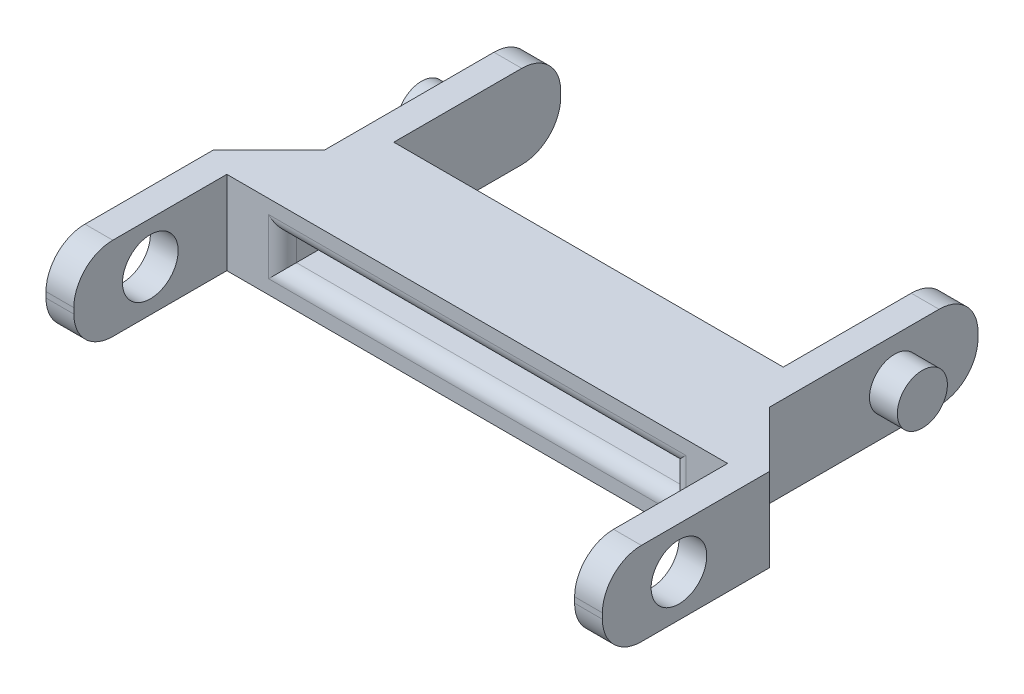
from build123d import *

# Parameters (mm, degrees)
SKETCH1_W           = 16
SKETCH1_H           = 3
SKETCH1_W_2         = 14
SKETCH1_H_2         = 1
EXTRUDE_THIN1_DEPTH = 2
SKETCH2_W           = 6
SKETCH2_H           = 3
BOSS_EXTRUDE1_DEPTH = 2
CHAMFER3_SIZE       = 2
SKETCH3_W           = 5.5
SKETCH3_H           = 3
CUT_EXTRUDE1_DEPTH  = 1
BOSS_EXTRUDE2_START = -1
SKETCH4_W           = 6
SKETCH4_H           = 3
BOSS_EXTRUDE2_DEPTH = 1
SKETCH5_W           = 6
SKETCH5_H           = 3
BOSS_EXTRUDE3_DEPTH = 1
CHAMFER4_SIZE       = 2
FILLET1_R           = 1.4
SKETCH7_R           = 1
CUT_EXTRUDE3_DEPTH  = 1
SKETCH8_R           = 0.9
BOSS_EXTRUDE5_DEPTH = 2
FILLET4_R           = 0.5
FILLET6_R           = 0.5


with BuildPart() as part:
    # Sketch1 → Extrude-Thin1 (new, symmetric)
    with BuildSketch(Plane.XY):
        Rectangle(SKETCH1_W, SKETCH1_H)
        Rectangle(SKETCH1_W_2, SKETCH1_H_2, mode=Mode.SUBTRACT)
    extrude(amount=EXTRUDE_THIN1_DEPTH, both=True)

    # Sketch2 → Boss-Extrude1 (add)
    with BuildSketch(Plane(origin=(8, 0, 0), x_dir=(0, 0, -1), z_dir=(1, 0, 0))):
        with Locations((-4.5, 0)):
            Rectangle(SKETCH2_W, SKETCH2_H)
    boss_extrude1 = extrude(amount=BOSS_EXTRUDE1_DEPTH)

    # Chamfer3
    chamfer3_edges = [part.edges().sort_by_distance(p)[0] for p in [
        (8, 0, 1.5),
    ]]
    chamfer(chamfer3_edges, length=CHAMFER3_SIZE - 0.0001)  # a hair under: the kernel refuses the full size

    # Sketch3 → Cut-Extrude1 (cut)
    with BuildSketch(Plane.ZY.offset(-8)):
        with Locations((4.75, 0)):
            Rectangle(SKETCH3_W, SKETCH3_H)
    cut_extrude1 = extrude(amount=-CUT_EXTRUDE1_DEPTH, mode=Mode.SUBTRACT)

    # Sketch4 → Boss-Extrude2 (add)
    with BuildSketch(Plane(origin=(8, 0, 0), x_dir=(0, 0, -1), z_dir=(1, 0, 0)).offset(BOSS_EXTRUDE2_START)):
        with Locations((5, 0)):
            Rectangle(SKETCH4_W, SKETCH4_H)
    extrude(amount=BOSS_EXTRUDE2_DEPTH)

    # Mirror2: Boss-Extrude1, Cut-Extrude1 across plane
    add(boss_extrude1.mirror(Plane(origin=(0, 0, 0), x_dir=(0, 0, 1), z_dir=(1, 0, 0))))
    add(cut_extrude1.mirror(Plane(origin=(0, 0, 0), x_dir=(0, 0, 1), z_dir=(1, 0, 0))), mode=Mode.SUBTRACT)

    # Sketch5 → Boss-Extrude3 (add)
    with BuildSketch(Plane.ZY.offset(8)):
        with Locations((-5, 0)):
            Rectangle(SKETCH5_W, SKETCH5_H)
    extrude(amount=-BOSS_EXTRUDE3_DEPTH)

    # Chamfer4
    chamfer4_edges = [part.edges().sort_by_distance(p)[0] for p in [
        (-8, 0, 1.5),
    ]]
    chamfer(chamfer4_edges, length=CHAMFER4_SIZE - 0.0001)  # a hair under: the kernel refuses the full size

    # Fillet1
    fillet1_edges = [part.edges().sort_by_distance(p)[0] for p in [
        (-7.5, 1.5, -8),
        (-7.5, -1.5, -8),
        (9.5, 1.5, 7.5),
        (9.5, -1.5, 7.5),
        (7.5, -1.5, -8),
        (7.5, 1.5, -8),
        (-9.5, -1.5, 7.5),
        (-9.5, 1.5, 7.5),
    ]]
    fillet(fillet1_edges, radius=FILLET1_R)

    # Sketch7 → Cut-Extrude3 (cut)
    with BuildSketch(Plane.ZY.offset(-9)):
        with Locations((4.75, 0)):
            Circle(SKETCH7_R)
    cut_extrude3 = extrude(amount=-CUT_EXTRUDE3_DEPTH, mode=Mode.SUBTRACT)

    # Mirror6: Cut-Extrude3 across plane
    add(cut_extrude3.mirror(Plane(origin=(0, 0, 0), x_dir=(0, 0, 1), z_dir=(1, 0, 0))), mode=Mode.SUBTRACT)

    # Sketch8 → Boss-Extrude5 (add)
    with BuildSketch(Plane(origin=(-7, 0, 0), x_dir=(0, 0, -1), z_dir=(1, 0, 0))):
        with Locations((5, 0)):
            Circle(SKETCH8_R)
    boss_extrude5 = extrude(amount=-BOSS_EXTRUDE5_DEPTH)

    # Mirror7: Boss-Extrude5 across plane
    add(boss_extrude5.mirror(Plane(origin=(0, 0, 0), x_dir=(0, 0, 1), z_dir=(1, 0, 0))))

    # Fillet4
    fillet4_edges = [part.edges().sort_by_distance(p)[0] for p in [
        (0, -0.5, -2),
        (0, 0.5, -2),
    ]]
    fillet(fillet4_edges, radius=FILLET4_R)

    # Fillet6
    fillet6_edges = [part.edges().sort_by_distance(p)[0] for p in [
        (-7, 0, 2),
        (0, -0.5, 2),
        (7, 0, 2),
        (0, 0.5, 2),
    ]]
    fillet(fillet6_edges, radius=FILLET6_R)


solid = part.part
